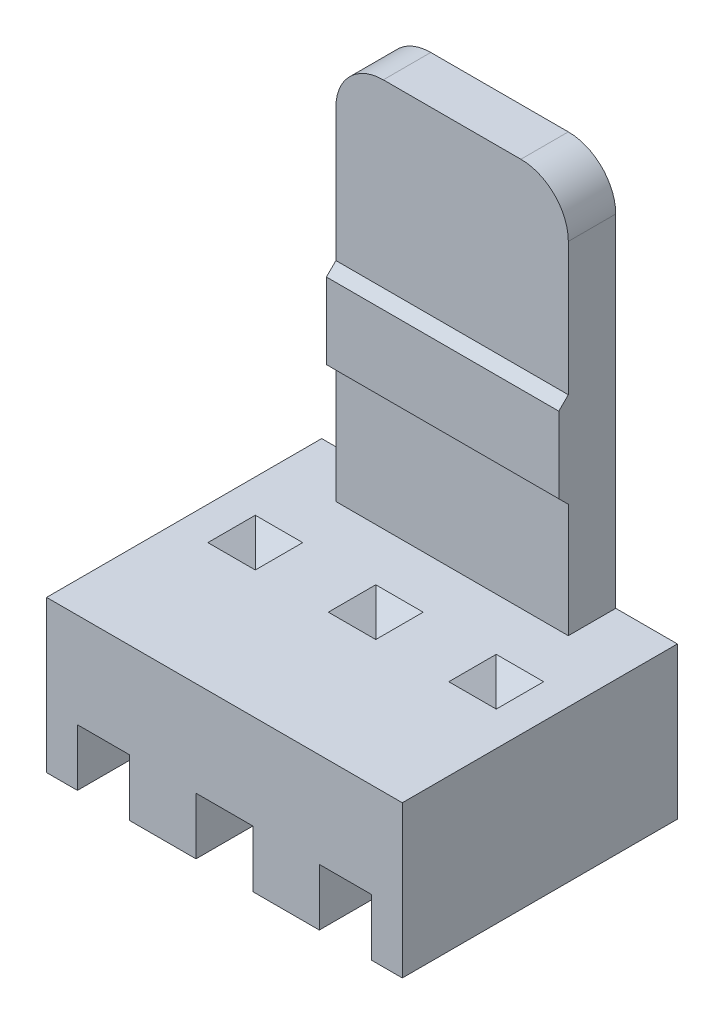
from build123d import *

# Parameters (mm, degrees)
EXTRUDE_1_DEPTH                  = 5.8
SKETCH_2_W                       = 4.9
SKETCH_2_H                       = 1
EXTRUDE_2_DEPTH                  = 8.2
SKETCH_3_W                       = 4.9
SKETCH_3_H                       = 2
EXTRUDE_3_DEPTH                  = 0.2
CHAMFER_1_SIZE                   = 0.2
FILLET_1_R                       = 1
SKETCH_4_W                       = 1
SKETCH_4_H                       = 1
CUT_EXTRUDE_1_DEPTH              = 0.5
CUT_EXTRUDE_1_DRAFT              = -44
PATTERN_LINEAR_1_COPY_1_SKETCH_W = 1
PATTERN_LINEAR_1_COPY_1_SKETCH_H = 1
PATTERN_LINEAR_1_COPY_1_DEPTH    = 0.5
PATTERN_LINEAR_1_COPY_1_DRAFT    = -44
PATTERN_LINEAR_1_COPY_2_SKETCH_W = 1
PATTERN_LINEAR_1_COPY_2_SKETCH_H = 1
PATTERN_LINEAR_1_COPY_2_DEPTH    = 0.5
PATTERN_LINEAR_1_COPY_2_DRAFT    = -44


with BuildPart() as part:
    # Эскиз1 → Бобышка-Вытянуть1 (new body)
    with BuildSketch(Plane.XY):
        Polygon((0, 0), (0, 3.2), (7.5, 3.2), (7.5, 0), (6.85, 0), (6.85, 1.2), (5.75, 1.2), (5.75, 0), (4.35, 0), (4.35, 1.2), (3.15, 1.2), (3.15, 0), (1.75, 0), (1.75, 1.2), (0.65, 1.2), (0.65, 0), align=None)
    extrude(amount=EXTRUDE_1_DEPTH)

    # Эскиз2 → Бобышка-Вытянуть2 (add)
    with BuildSketch(Plane(origin=(0, 3.2, 0), x_dir=(1, 0, 0), z_dir=(0, 1, 0))):
        with Locations((3.75, -0.5)):
            Rectangle(SKETCH_2_W, SKETCH_2_H)
    extrude(amount=EXTRUDE_2_DEPTH)

    # Эскиз3 → Бобышка-Вытянуть3 (add)
    with BuildSketch(Plane.XY.offset(1)):
        with Locations((3.75, 6.6)):
            Rectangle(SKETCH_3_W, SKETCH_3_H)
    extrude(amount=EXTRUDE_3_DEPTH)

    # Фаска1
    chamfer_1_edges = [part.edges().sort_by_distance(p)[0] for p in [
        (3.75, 5.6, 1.2),
        (3.75, 7.6, 1.2),
    ]]
    chamfer(chamfer_1_edges, length=CHAMFER_1_SIZE - 0.0001)  # a hair under: the kernel refuses the full size

    # Скругление1
    fillet_1_edges = [part.edges().sort_by_distance(p)[0] for p in [
        (1.3, 11.4, 0.5),
        (6.2, 11.4, 0.5),
    ]]
    fillet(fillet_1_edges, radius=FILLET_1_R)


with BuildPart() as cut_extrude_1_tool:
    # Эскиз4 → Вырез-Вытянуть1 (with draft: the straight prism first)
    with BuildSketch(Plane(origin=(0, 3.2, 0), x_dir=(1, 0, 0), z_dir=(0, 1, 0))):
        with Locations((1.2, -2.6)):
            Rectangle(SKETCH_4_W, SKETCH_4_H)
    extrude(amount=-CUT_EXTRUDE_1_DEPTH)
    # Вырез-Вытянуть1: the draft: its side faces are tilted about the plane it starts from
    cut_extrude_1_sides = [cut_extrude_1_tool.faces().sort_by_distance(p)[0] for p in [
        (0.7, 2.95, 2.6),
        (1.2, 2.95, 3.1),
        (1.7, 2.95, 2.6),
        (1.2, 2.95, 2.1),
    ]]
    draft(cut_extrude_1_sides, Plane(origin=(0, 3.2, 0), x_dir=(1, 0, 0), z_dir=(0, 1, 0)), CUT_EXTRUDE_1_DRAFT)


with BuildPart() as part_1:
    add(part.part)

    # Вырез-Вытянуть1: cut by cut_extrude_1_tool
    add(cut_extrude_1_tool.part, mode=Mode.SUBTRACT)


with BuildPart() as pattern_linear_1_copy_1_tool:
    # Линейный массив1 copy 1 sketch → Линейный массив1 copy 1 (with draft: the straight prism first)
    with BuildSketch(Plane(origin=(2.54, 3.2, 0), x_dir=(1, 0, 0), z_dir=(0, 1, 0))):
        with Locations((1.2, -2.6)):
            Rectangle(PATTERN_LINEAR_1_COPY_1_SKETCH_W, PATTERN_LINEAR_1_COPY_1_SKETCH_H)
    extrude(amount=-PATTERN_LINEAR_1_COPY_1_DEPTH)
    # Линейный массив1 copy 1: the draft: its side faces are tilted about the plane it starts from
    pattern_linear_1_copy_1_sides = [pattern_linear_1_copy_1_tool.faces().sort_by_distance(p)[0] for p in [
        (3.24, 2.95, 2.6),
        (3.74, 2.95, 3.1),
        (4.24, 2.95, 2.6),
        (3.74, 2.95, 2.1),
    ]]
    draft(pattern_linear_1_copy_1_sides, Plane(origin=(2.54, 3.2, 0), x_dir=(1, 0, 0), z_dir=(0, 1, 0)), PATTERN_LINEAR_1_COPY_1_DRAFT)


with BuildPart() as part_2:
    add(part_1.part)

    # Линейный массив1 copy 1: cut by pattern_linear_1_copy_1_tool
    add(pattern_linear_1_copy_1_tool.part, mode=Mode.SUBTRACT)


with BuildPart() as pattern_linear_1_copy_2_tool:
    # Линейный массив1 copy 2 sketch → Линейный массив1 copy 2 (with draft: the straight prism first)
    with BuildSketch(Plane(origin=(5.08, 3.2, 0), x_dir=(1, 0, 0), z_dir=(0, 1, 0))):
        with Locations((1.2, -2.6)):
            Rectangle(PATTERN_LINEAR_1_COPY_2_SKETCH_W, PATTERN_LINEAR_1_COPY_2_SKETCH_H)
    extrude(amount=-PATTERN_LINEAR_1_COPY_2_DEPTH)
    # Линейный массив1 copy 2: the draft: its side faces are tilted about the plane it starts from
    pattern_linear_1_copy_2_sides = [pattern_linear_1_copy_2_tool.faces().sort_by_distance(p)[0] for p in [
        (5.78, 2.95, 2.6),
        (6.28, 2.95, 3.1),
        (6.78, 2.95, 2.6),
        (6.28, 2.95, 2.1),
    ]]
    draft(pattern_linear_1_copy_2_sides, Plane(origin=(5.08, 3.2, 0), x_dir=(1, 0, 0), z_dir=(0, 1, 0)), PATTERN_LINEAR_1_COPY_2_DRAFT)


with BuildPart() as part_3:
    add(part_2.part)

    # Линейный массив1 copy 2: cut by pattern_linear_1_copy_2_tool
    add(pattern_linear_1_copy_2_tool.part, mode=Mode.SUBTRACT)


solid = part_3.part
